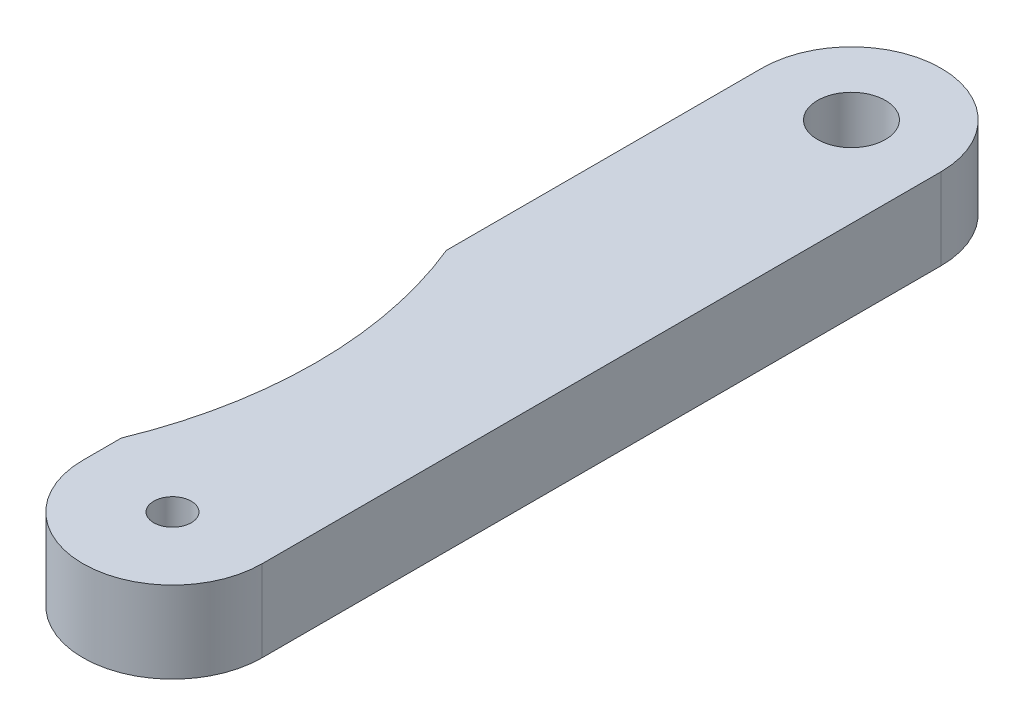
from build123d import *

# Parameters (mm, degrees)
BOSS_EXTRUDE1_DEPTH   = 3.81
F_4_40_TAPPED_HOLE1_D = 1.7526
CUT_EXTRUDE1_DEPTH    = 31.915752916
SKETCH5_R             = 1.5875
CUT_EXTRUDE2_DEPTH    = 31.915752916


with BuildPart() as part:
    # Sketch1 → Boss-Extrude1 (new body)
    with BuildSketch(Plane(origin=(0, 0, 0), x_dir=(1, 0, 0), z_dir=(0, 1, 0))):
        with BuildLine():
            Line((0.307655172, 6.517241379), (0.307655172, -25.232758621))
            ThreePointArc((0.307655172, -25.232758621), (4.498655172, -29.423758621), (8.689655172, -25.232758621))
            Line((8.689655172, -25.232758621), (8.689655172, 6.517241379))
            ThreePointArc((8.689655172, 6.517241379), (4.498655172, 10.708241379), (0.307655172, 6.517241379))
        make_face()
    extrude(amount=BOSS_EXTRUDE1_DEPTH)

    # #4-40 Tapped Hole1 (through all)
    with Locations(Plane(origin=(0, 3.81, 0), x_dir=(1, 0, 0), z_dir=(0, 1, 0))):
        with Locations((4.498655172, 6.517241379), (4.498655172, -25.232758621)):
            Hole(F_4_40_TAPPED_HOLE1_D / 2)

    # Sketch4 → Cut-Extrude1 (cut, through all)
    with BuildSketch(Plane(origin=(0, 3.81, 0), x_dir=(1, 0, 0), z_dir=(0, 1, 0))):
        with BuildLine():
            Line((0.307655172, -23.434100697), (0.307655172, -8.235416544))
            ThreePointArc((0.307655172, -8.235416544), (1.807655172, -15.834758621), (0.307655172, -23.434100697))
        make_face()
    extrude(amount=-CUT_EXTRUDE1_DEPTH, mode=Mode.SUBTRACT)

    # Sketch5 → Cut-Extrude2 (cut, through all)
    with BuildSketch(Plane(origin=(0, 3.81, 0), x_dir=(1, 0, 0), z_dir=(0, 1, 0))):
        with Locations((4.498655172, 6.517241379)):
            Circle(SKETCH5_R)
    extrude(amount=-CUT_EXTRUDE2_DEPTH, mode=Mode.SUBTRACT)


solid = part.part
